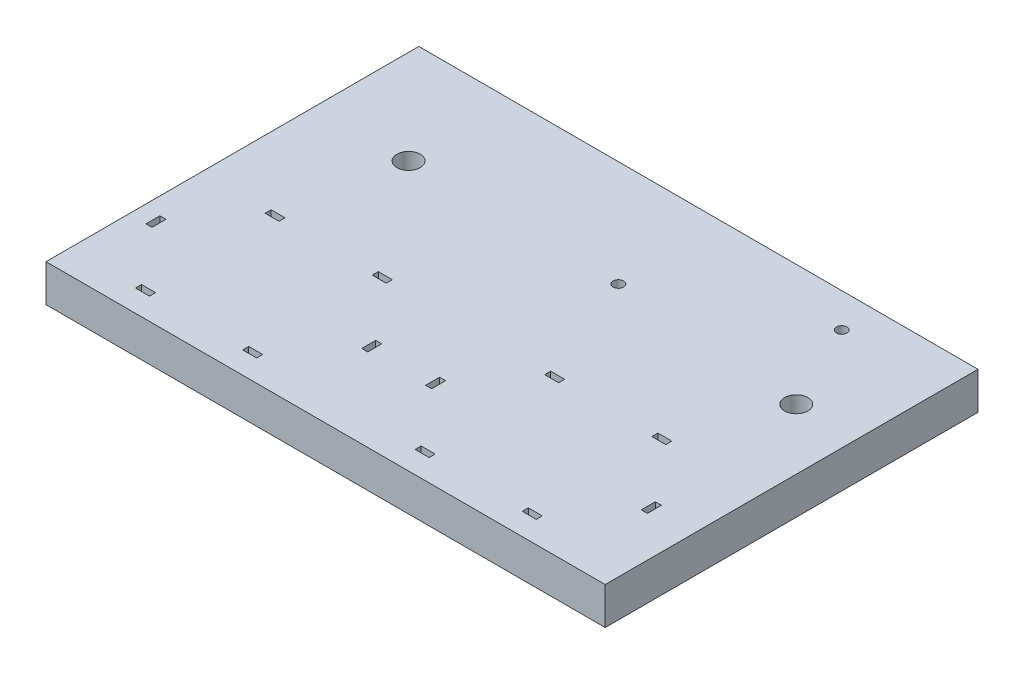
from build123d import *

# Parameters (mm, degrees)
SKETCH1_W           = 120
SKETCH1_H           = 80
SKETCH1_R           = 2.5
SKETCH1_R_2         = 1.13
SKETCH1_W_2         = 3
SKETCH1_H_2         = 1.3
SKETCH1_W_3         = 1.3
SKETCH1_H_3         = 3
BOSS_EXTRUDE1_DEPTH = 8


with BuildPart() as part:
    # Sketch1 → Boss-Extrude1 (new body)
    with BuildSketch(Plane(origin=(0, 0, 0), x_dir=(1, 0, 0), z_dir=(0, 1, 0))):
        Rectangle(SKETCH1_W, SKETCH1_H)
        with Locations((-39.823045535, 17.627318551)):
            Circle(SKETCH1_R, mode=Mode.SUBTRACT)
        with Locations((47, 14)):
            Circle(SKETCH1_R, mode=Mode.SUBTRACT)
        with Locations((38.07, 32.68)):
            Circle(SKETCH1_R_2, mode=Mode.SUBTRACT)
        with Locations((5.56, 17.26)):
            Circle(SKETCH1_R_2, mode=Mode.SUBTRACT)
        with Locations((16, -34.65)):
            Rectangle(SKETCH1_W_2, SKETCH1_H_2, mode=Mode.SUBTRACT)
        with Locations((16, -6.85)):
            Rectangle(SKETCH1_W_2, SKETCH1_H_2, mode=Mode.SUBTRACT)
        with Locations((39, -6.85)):
            Rectangle(SKETCH1_W_2, SKETCH1_H_2, mode=Mode.SUBTRACT)
        with Locations((39, -34.65)):
            Rectangle(SKETCH1_W_2, SKETCH1_H_2, mode=Mode.SUBTRACT)
        with Locations((50.65, -20.75)):
            Rectangle(SKETCH1_W_3, SKETCH1_H_3, mode=Mode.SUBTRACT)
        with Locations((4.35, -20.75)):
            Rectangle(SKETCH1_W_3, SKETCH1_H_3, mode=Mode.SUBTRACT)
        with Locations((-55.65, -20.75)):
            Rectangle(SKETCH1_W_3, SKETCH1_H_3, mode=Mode.SUBTRACT)
        with Locations((-9.35, -20.75)):
            Rectangle(SKETCH1_W_3, SKETCH1_H_3, mode=Mode.SUBTRACT)
        with Locations((-44, -34.65)):
            Rectangle(SKETCH1_W_2, SKETCH1_H_2, mode=Mode.SUBTRACT)
        with Locations((-44, -6.85)):
            Rectangle(SKETCH1_W_2, SKETCH1_H_2, mode=Mode.SUBTRACT)
        with Locations((-21, -34.65)):
            Rectangle(SKETCH1_W_2, SKETCH1_H_2, mode=Mode.SUBTRACT)
        with Locations((-21, -6.85)):
            Rectangle(SKETCH1_W_2, SKETCH1_H_2, mode=Mode.SUBTRACT)
    extrude(amount=BOSS_EXTRUDE1_DEPTH)


solid = part.part
